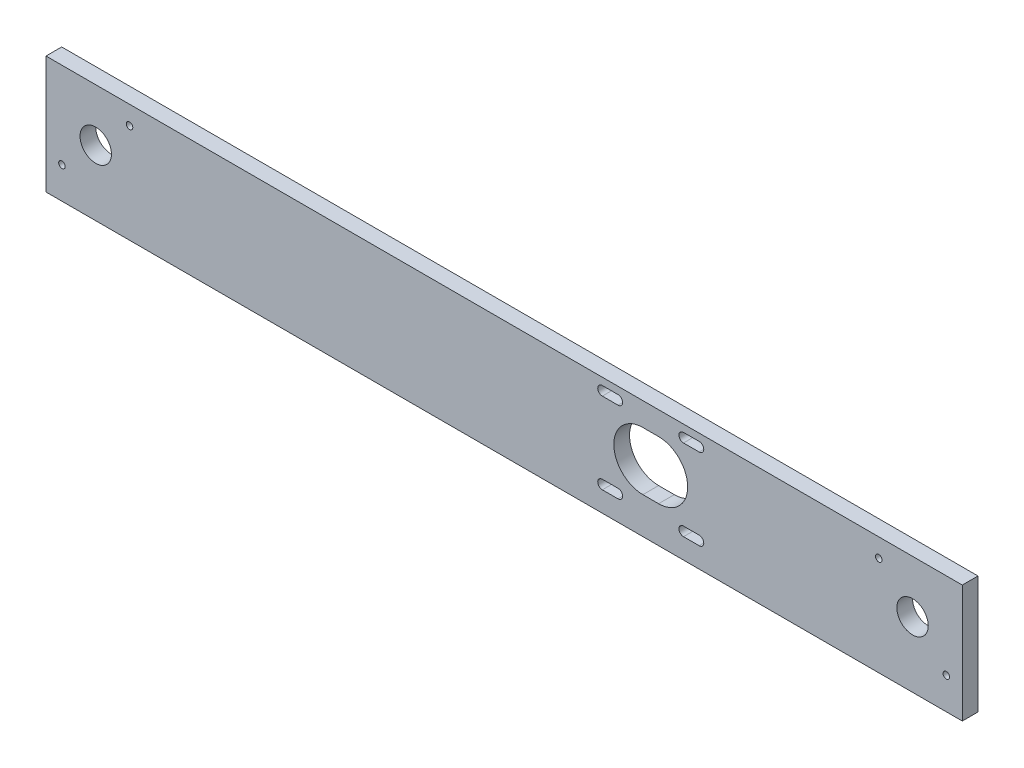
from build123d import *

# Parameters (mm, degrees)
CROQUIS1_W              = 350
CROQUIS1_H              = 45
SALIENTE_EXTRUIR1_DEPTH = 6
CROQUIS2_R              = 6
CROQUIS2_R_2            = 1.25
CORTAR_EXTRUIR1_DEPTH   = 353.932004783
CORTAR_EXTRUIR2_DEPTH   = 353.932004783


with BuildPart() as part:
    # Croquis1 → Saliente-Extruir1 (new body)
    with BuildSketch(Plane.XY):
        with Locations((-175, -22.5)):
            Rectangle(CROQUIS1_W, CROQUIS1_H)
    extrude(amount=SALIENTE_EXTRUIR1_DEPTH)

    # Croquis2 → Cortar-Extruir1 (cut, through all)
    with BuildSketch(Plane.XY.offset(6)):
        with Locations((-331, -20)):
            Circle(CROQUIS2_R)
        with Locations((-19, -20)):
            Circle(CROQUIS2_R)
        with Locations((-318.095301243, -7.095301243)):
            Circle(CROQUIS2_R_2)
        with Locations((-343.904698757, -32.904698757)):
            Circle(CROQUIS2_R_2)
        with Locations((-31.904698757, -7.095301243)):
            Circle(CROQUIS2_R_2)
        with Locations((-6.095301243, -32.904698757)):
            Circle(CROQUIS2_R_2)
    extrude(amount=-CORTAR_EXTRUIR1_DEPTH, mode=Mode.SUBTRACT)

    # Croquis3 → Cortar-Extruir2 (cut, through all)
    with BuildSketch(Plane.XY.offset(6)):
        with BuildLine():
            Line((-137.5, -2.75), (-131.5, -2.75))
            ThreePointArc((-131.5, -2.75), (-129.75, -4.5), (-131.5, -6.25))
            Line((-131.5, -6.25), (-137.5, -6.25))
            ThreePointArc((-137.5, -6.25), (-139.25, -4.5), (-137.5, -2.75))
        make_face()
        with BuildLine():
            Line((-122, -8.9), (-116, -8.9))
            ThreePointArc((-116, -8.9), (-104.9, -20), (-116, -31.1))
            Line((-116, -31.1), (-122, -31.1))
            ThreePointArc((-122, -31.1), (-133.1, -20), (-122, -8.9))
        make_face()
        with BuildLine():
            Line((-137.5, -33.75), (-131.5, -33.75))
            ThreePointArc((-131.5, -33.75), (-129.75, -35.5), (-131.5, -37.25))
            Line((-131.5, -37.25), (-137.5, -37.25))
            ThreePointArc((-137.5, -37.25), (-139.25, -35.5), (-137.5, -33.75))
        make_face()
        with BuildLine():
            Line((-106.5, -2.75), (-100.5, -2.75))
            ThreePointArc((-100.5, -2.75), (-98.75, -4.5), (-100.5, -6.25))
            Line((-100.5, -6.25), (-106.5, -6.25))
            ThreePointArc((-106.5, -6.25), (-108.25, -4.5), (-106.5, -2.75))
        make_face()
        with BuildLine():
            Line((-106.5, -33.75), (-100.5, -33.75))
            ThreePointArc((-100.5, -33.75), (-98.75, -35.5), (-100.5, -37.25))
            Line((-100.5, -37.25), (-106.5, -37.25))
            ThreePointArc((-106.5, -37.25), (-108.25, -35.5), (-106.5, -33.75))
        make_face()
    extrude(amount=-CORTAR_EXTRUIR2_DEPTH, mode=Mode.SUBTRACT)


solid = part.part
